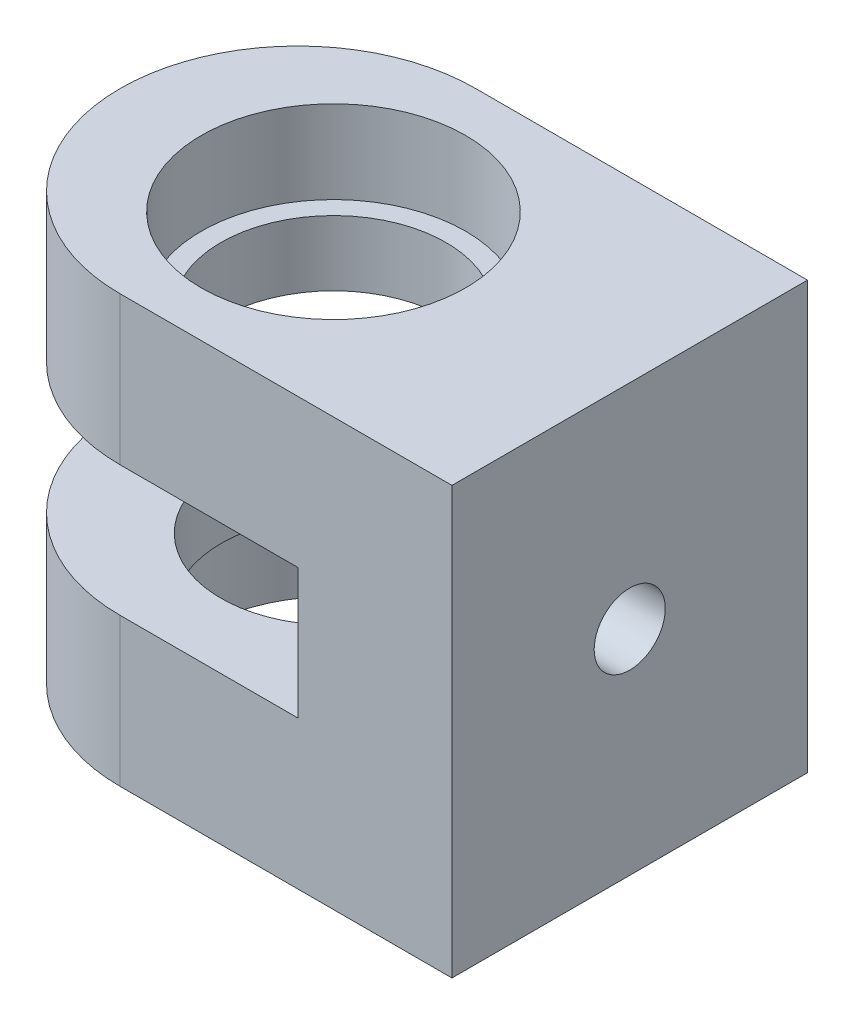
from build123d import *

# Parameters (mm, degrees)
SKETCH1_W           = 43
SKETCH1_H           = 30
BOSS_EXTRUDE1_DEPTH = 36
SKETCH2_W           = 30
SKETCH2_H           = 11
CUT_EXTRUDE1_DEPTH  = 30
SKETCH3_R           = 11.15
CUT_EXTRUDE2_DEPTH  = 7
CUT_EXTRUDE3_START  = -7
SKETCH4_R           = 11.15
CUT_EXTRUDE3_DEPTH  = 7
SKETCH5_R           = 9.5
CUT_EXTRUDE4_DEPTH  = 40.092838219
CUT_EXTRUDE5_DEPTH  = 5
SKETCH7_R           = 3
CUT_EXTRUDE6_DEPTH  = 53.402290026
FILLET2_R           = 15


with BuildPart() as part:
    # Sketch1 → Boss-Extrude1 (new body)
    with BuildSketch(Plane(origin=(0, 0, 0), x_dir=(1, 0, 0), z_dir=(0, 1, 0))):
        Rectangle(SKETCH1_W, SKETCH1_H)
    extrude(amount=BOSS_EXTRUDE1_DEPTH)

    # Sketch2 → Cut-Extrude1 (cut)
    with BuildSketch(Plane.ZY.offset(21.5)):
        with Locations((0, 18)):
            Rectangle(SKETCH2_W, SKETCH2_H)
    extrude(amount=-CUT_EXTRUDE1_DEPTH, mode=Mode.SUBTRACT)

    # Sketch3 → Cut-Extrude2 (cut)
    with BuildSketch(Plane(origin=(0, 36, 0), x_dir=(1, 0, 0), z_dir=(0, 1, 0))):
        with Locations(Location((-3.5, 0, 0), (0, 0, 270))):
            Circle(SKETCH3_R)
    extrude(amount=-CUT_EXTRUDE2_DEPTH, mode=Mode.SUBTRACT)

    # Sketch4 → Cut-Extrude3 (cut)
    with BuildSketch(Plane.XZ.offset(CUT_EXTRUDE3_START)):
        with Locations(Location((-3.5, 0, 0), (0, 0, 90))):
            Circle(SKETCH4_R)
    extrude(amount=CUT_EXTRUDE3_DEPTH, mode=Mode.SUBTRACT)

    # Sketch5 → Cut-Extrude4 (cut, through all)
    with BuildSketch(Plane(origin=(0, 29, 0), x_dir=(1, 0, 0), z_dir=(0, 1, 0))):
        with Locations(Location((-3.5, 0, 0), (0, 0, 90))):
            Circle(SKETCH5_R)
    extrude(amount=-CUT_EXTRUDE4_DEPTH, mode=Mode.SUBTRACT)

    # Sketch6 → Cut-Extrude5 (cut)
    with BuildSketch(Plane.ZY.offset(-8.5)):
        Polygon((-3, 23.196152423), (-6, 18), (-3, 12.803847577), (3, 12.803847577), (6, 18), (3, 23.196152423), align=None)
    extrude(amount=-CUT_EXTRUDE5_DEPTH, mode=Mode.SUBTRACT)

    # Sketch7 → Cut-Extrude6 (cut, through all)
    with BuildSketch(Plane.ZY.offset(-13.5)):
        with Locations((0, 18)):
            Circle(SKETCH7_R)
    extrude(amount=-CUT_EXTRUDE6_DEPTH, mode=Mode.SUBTRACT)

    # Fillet2
    fillet2_edges = [part.edges().sort_by_distance(p)[0] for p in [
        (-21.5, 6.25, -15),
        (-21.5, 6.25, 15),
        (-21.5, 29.75, 15),
        (-21.5, 29.75, -15),
    ]]
    fillet(fillet2_edges, radius=FILLET2_R - 0.0001)  # a hair under: the kernel refuses the full size


solid = part.part
